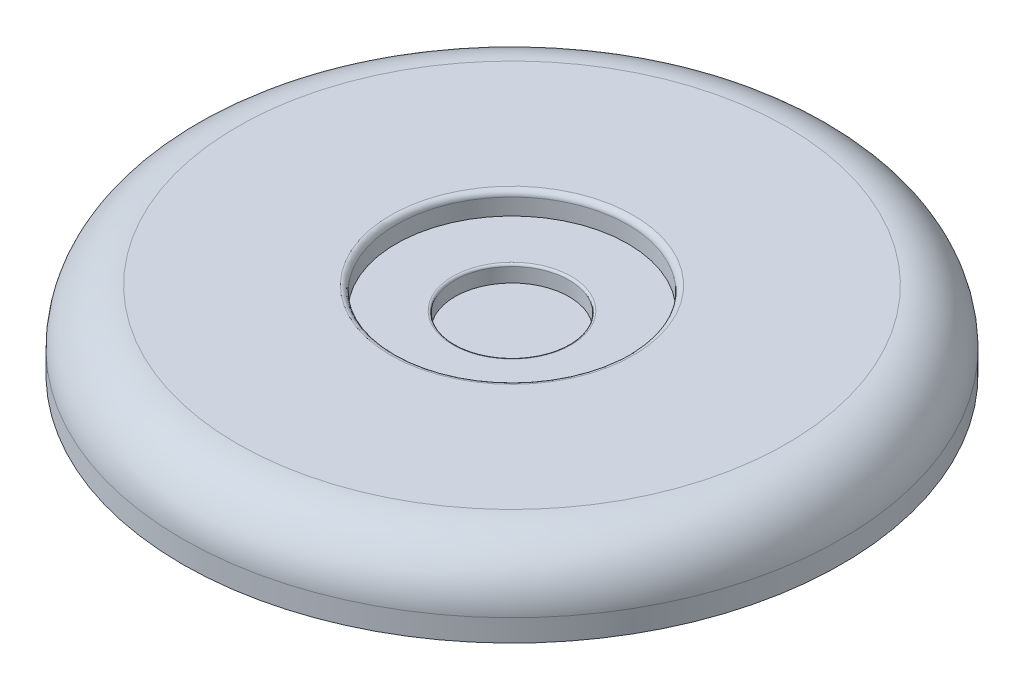
from build123d import *

# Parameters (mm, degrees)
FILLET1_R          = 0.5
SKETCH2_R          = 5.2
CUT_EXTRUDE1_DEPTH = 1.5
FILLET2_R          = 0.2
FILLET3_R          = 5


with BuildPart() as part:
    # Sketch1 → Revolve1 (revolve)
    with BuildSketch(Plane(origin=(0, 0, 0), x_dir=(0, 0, -1), z_dir=(1, 0, 0))):
        Polygon((0, 0), (-30, 0), (-30, 7), (-20.102542457, 7), (-10.55, 7), (-10.55, 5), (0, 5), align=None)
    revolve(axis=Axis((0, 5, 0), (0, -1, 0)))

    # Fillet1
    fillet1_edges = [part.edges().sort_by_distance(p)[0] for p in [
        (0, 7, -10.55),
    ]]
    fillet(fillet1_edges, radius=FILLET1_R)

    # Sketch2 → Cut-Extrude1 (cut)
    with BuildSketch(Plane(origin=(0, 5, 0), x_dir=(1, 0, 0), z_dir=(0, 1, 0))):
        Circle(SKETCH2_R)
    extrude(amount=-CUT_EXTRUDE1_DEPTH, mode=Mode.SUBTRACT)

    # Fillet2
    fillet2_edges = [part.edges().sort_by_distance(p)[0] for p in [
        (-5.2, 5, 0),
    ]]
    fillet(fillet2_edges, radius=FILLET2_R)

    # Fillet3
    fillet3_edges = [part.edges().sort_by_distance(p)[0] for p in [
        (0, 7, -30),
    ]]
    fillet(fillet3_edges, radius=FILLET3_R)


solid = part.part
